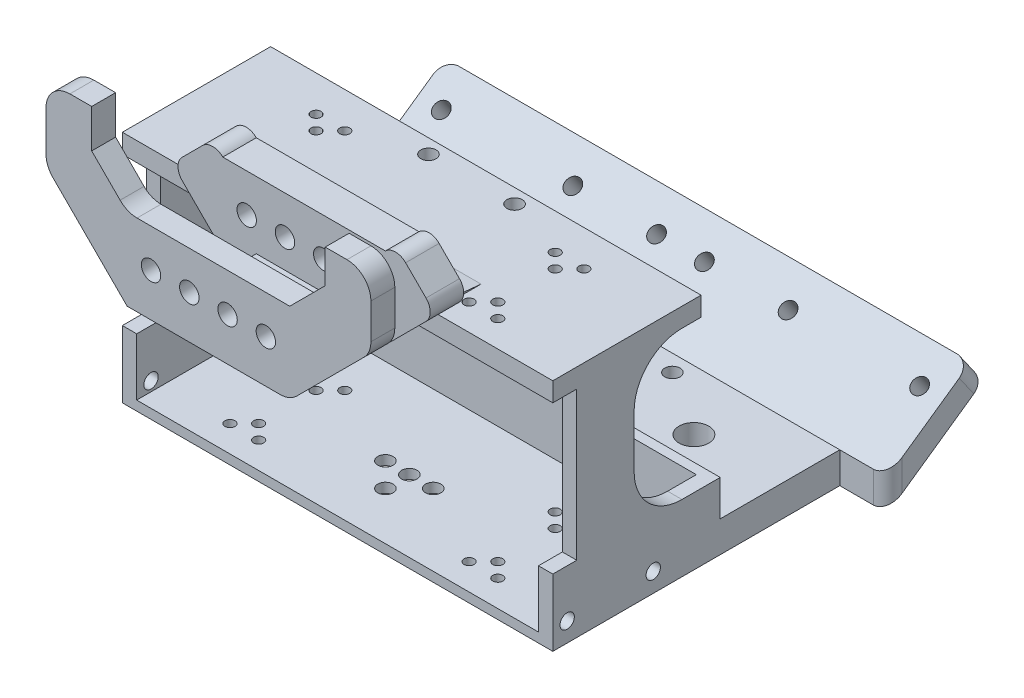
from build123d import *

# Parameters (mm, degrees)
EXTRUDE_1_DEPTH          = 4
EXTRUDE_2_DEPTH          = 7
EXTRUDE_3_DEPTH          = 15
EXTRUDE_4_DEPTH          = 5
CUT_EXTRUDE_2_REACH      = 93.694
SKETCH_6_R               = 2.03
EXTRUDE_5_DEPTH          = 31
EXTRUDE_6_DEPTH          = 12
EXTRUDE_7_DEPTH          = 2
CUT_EXTRUDE_3_DEPTH      = 103.59409284410384
CUT_EXTRUDE_3_DEPTH_BACK = 103.59409284410384
SKETCH_14_R              = 1.049999999999995
SKETCH_14_R_2            = 1.0499999999999985
SKETCH_14_R_3            = 1.049999999999999
SKETCH_14_R_4            = 1.0499999999999987
SKETCH_14_R_5            = 1.050000000000002
SKETCH_14_R_6            = 1.0499999999999916
FILLET_3_R               = 10
FILLET_5_R               = 5
FILLET_9_R               = 3
CUT_EXTRUDE_4_REACH      = 85.223
SKETCH_16_W              = 90.00000000000001
SKETCH_16_H              = 15
EXTRUDE_8_DEPTH          = 25
CUT_EXTRUDE_6_REACH      = 104.594
SKETCH_22_R              = 1.6000000000000003
SKETCH_22_R_2            = 1.6
SKETCH_25_R              = 1.6000000000000019
CUT_EXTRUDE_7_DEPTH      = 4
EXTRUDE_10_DEPTH         = 20
EXTRUDE_11_DEPTH         = 55
CUT_EXTRUDE_8_REACH      = 129.959
SKETCH_31_R              = 1.5999999999999985
SKETCH_31_R_2            = 1.6
SKETCH_31_R_3            = 1.6000000000000019
CUT_EXTRUDE_9_REACH      = 108.605
SKETCH_32_R              = 1.5999999999999992
SKETCH_32_R_2            = 1.6
SKETCH_32_R_3            = 1.6000000000000019
SKETCH_32_R_4            = 1.6000000000000008
SKETCH_32_R_5            = 3.0999999999999996
SKETCH_32_R_6            = 3.0999999999999983
FILLET_12_R              = 3
SKETCH_33_R              = 1.5000000000000004
SKETCH_33_R_2            = 1.5000000000000009
CUT_EXTRUDE_10_DEPTH     = 124.80958192613329


with BuildPart() as part:
    # 草图1 → 凸台-拉伸1 (new body)
    with BuildSketch(Plane(origin=(0, 0, 0), x_dir=(1, 0, 0), z_dir=(0, 1, 0))):
        Polygon((-45.000000000000014, 23), (44.999999999999986, 23), (45, -23), (-45.00000000000001, -23), align=None)
    extrude(amount=EXTRUDE_1_DEPTH)

    # 草图3 → 凸台-拉伸2 (add)
    with BuildSketch(Plane.XY.offset(23)):
        Polygon((-17, 0), (17, 0), (27.606601717798192, 10.606601717798231), (19.10660171779818, 19.106601717798203), (16.999999999999996, 17), (-17.000000000000004, 17), (-19.10660171779818, 19.106601717798203), (-27.606601717798192, 10.606601717798231), align=None)
    extrude(amount=EXTRUDE_2_DEPTH)

    # 草图4 → 凸台-拉伸3 (add)
    with BuildSketch(Plane.XY.offset(30)):
        Polygon((-9.999999999999934, 3.000000000000002), (10.000000000000068, 3.0000000000000013), (10.000000000000068, -1.8e-16), (-9.999999999999932, 1.07e-15), align=None)
    extrude(amount=EXTRUDE_3_DEPTH)

    # 草图5 → 凸台-拉伸4 (add)
    with BuildSketch(Plane.XY.offset(45)):
        Polygon((-33.9632034355964, 25.46320343559641), (-33.963203435596405, 32.46320343559642), (-24.4099025766973, 32.46320343559642), (-24.409902576697295, 24.409902576697302), (-19.10660171779818, 19.106601717798203), (-17.000000000000004, 17), (16.999999999999996, 17), (19.10660171779818, 19.106601717798203), (24.409902576697277, 24.40990257669732), (24.40990257669728, 31.40990257669732), (33.963203435596384, 31.40990257669732), (33.96320343559638, 25.463203435596437), (33.96320343559638, 16.963203435596416), (27.606601717798192, 10.606601717798231), (17, 0), (-17, 0), (-27.606601717798178, 10.60660171779821), (-33.9632034355964, 16.963203435596423), align=None)
    extrude(amount=EXTRUDE_4_DEPTH)

    # 切除-拉伸2: up to this face of the body (flat: up to its plane)
    cut_extrude_2_end = Plane(part.part.faces().sort_by_distance((0, 10.613576842, 23))[0])
    # 草图6 → 切除-拉伸2 (cut, up to the picked face)
    with BuildSketch(Plane.XY.offset(49.99999999999999), mode=Mode.PRIVATE) as cut_extrude_2_sk1:
        with Locations((-12.000000000000004, 9)):
            Circle(SKETCH_6_R)
    cut_extrude_2_tool1 = split(extrude(cut_extrude_2_sk1.sketch, amount=-CUT_EXTRUDE_2_REACH, mode=Mode.PRIVATE), bisect_by=cut_extrude_2_end, keep=Keep.BOTH, mode=Mode.PRIVATE)
    # 草图6 → 切除-拉伸2 (cut, up to the picked face)
    with BuildSketch(Plane.XY.offset(49.99999999999999), mode=Mode.PRIVATE) as cut_extrude_2_sk2:
        with Locations((-4.0000000000000036, 9)):
            Circle(SKETCH_6_R)
    cut_extrude_2_tool2 = split(extrude(cut_extrude_2_sk2.sketch, amount=-CUT_EXTRUDE_2_REACH, mode=Mode.PRIVATE), bisect_by=cut_extrude_2_end, keep=Keep.BOTH, mode=Mode.PRIVATE)
    # 草图6 → 切除-拉伸2 (cut, up to the picked face)
    with BuildSketch(Plane.XY.offset(49.99999999999999), mode=Mode.PRIVATE) as cut_extrude_2_sk3:
        with Locations((3.9999999999999964, 9)):
            Circle(SKETCH_6_R)
    cut_extrude_2_tool3 = split(extrude(cut_extrude_2_sk3.sketch, amount=-CUT_EXTRUDE_2_REACH, mode=Mode.PRIVATE), bisect_by=cut_extrude_2_end, keep=Keep.BOTH, mode=Mode.PRIVATE)
    # 草图6 → 切除-拉伸2 (cut, up to the picked face)
    with BuildSketch(Plane.XY.offset(49.99999999999999), mode=Mode.PRIVATE) as cut_extrude_2_sk4:
        with Locations((11.999999999999996, 9)):
            Circle(SKETCH_6_R)
    cut_extrude_2_tool4 = split(extrude(cut_extrude_2_sk4.sketch, amount=-CUT_EXTRUDE_2_REACH, mode=Mode.PRIVATE), bisect_by=cut_extrude_2_end, keep=Keep.BOTH, mode=Mode.PRIVATE)
    add(cut_extrude_2_tool1.solids().sort_by(Axis((-12, 9, 50), (0, 0, -1)))[0], mode=Mode.SUBTRACT)
    add(cut_extrude_2_tool2.solids().sort_by(Axis((-4, 9, 50), (0, 0, -1)))[0], mode=Mode.SUBTRACT)
    add(cut_extrude_2_tool3.solids().sort_by(Axis((4, 9, 50), (0, 0, -1)))[0], mode=Mode.SUBTRACT)
    add(cut_extrude_2_tool4.solids().sort_by(Axis((12, 9, 50), (0, 0, -1)))[0], mode=Mode.SUBTRACT)

    # 草图11 → 凸台-拉伸5 (add)
    with BuildSketch(Plane.XZ):
        Polygon((-45.000000000000014, 17.999999999999996), (-42.00000000000001, 18), (-42.00000000000001, 5.999999999999995), (-45.000000000000014, 5.999999999999995), align=None)
        Polygon((45.000000000000014, 6.000000000000006), (42.00000000000001, 6.000000000000005), (42.00000000000001, 18.00000000000001), (45.000000000000014, 18.000000000000007), align=None)
    extrude(amount=EXTRUDE_5_DEPTH)

    # 草图12 → 凸台-拉伸6 (add)
    with BuildSketch(Plane.XZ.offset(31)):
        Polygon((42, -10.000000000000004), (42.00000000000001, 23.000000000000004), (45, 23), (44.99999999999999, -12.000000000000004), (-45.000000000000014, -12.000000000000004), (-45.00000000000001, 23), (-42.00000000000001, 23.000000000000004), (-42, -10.000000000000004), align=None)
    extrude(amount=EXTRUDE_6_DEPTH)

    # 草图13 → 凸台-拉伸7 (add)
    with BuildSketch(Plane.XZ.offset(43)):
        Polygon((-45.00000000000001, 23), (44.99999999999999, 23), (44.99999999999999, -12.000000000000004), (-45, -12.000000000000004), align=None)
    extrude(amount=EXTRUDE_7_DEPTH)

    # 草图14 → 切除-拉伸3 (cut, two sides: drawn at the far end of the back side and taken through both)
    with BuildSketch(Plane.XZ.offset(45).offset(-CUT_EXTRUDE_3_DEPTH_BACK)):
        with Locations(Location((22.000000000000007, 17.499999999999993, 0), (0, 0, 270))):
            Circle(SKETCH_14_R)
        with Locations(Location((28, 17.499999999999996, 0), (0, 0, 270))):
            Circle(SKETCH_14_R_2)
        with Locations(Location((25, 14.499999999999995, 0), (0, 0, 270))):
            Circle(SKETCH_14_R_3)
        with Locations(Location((22.000000000000007, -0.5000000000000004, 0), (0, 0, 270))):
            Circle(SKETCH_14_R)
        with Locations(Location((25, 2.499999999999995, 0), (0, 0, 270))):
            Circle(SKETCH_14_R_4)
        with Locations(Location((28, -0.5000000000000039, 0), (0, 0, 270))):
            Circle(SKETCH_14_R_4)
        with Locations(Location((-28, -0.5000000000000108, 0), (0, 0, 270))):
            Circle(SKETCH_14_R_5)
        with Locations(Location((-22.000000000000007, -0.5000000000000059, 0), (0, 0, 270))):
            Circle(SKETCH_14_R_4)
        with Locations(Location((-25, 2.4999999999999893, 0), (0, 0, 270))):
            Circle(SKETCH_14_R_4)
        with Locations(Location((-22.000000000000007, 17.499999999999986, 0), (0, 0, 270))):
            Circle(SKETCH_14_R_6)
        with Locations(Location((-25, 14.49999999999999, 0), (0, 0, 270))):
            Circle(SKETCH_14_R_3)
        with Locations(Location((-28, 17.49999999999999, 0), (0, 0, 270))):
            Circle(SKETCH_14_R_2)
    extrude(amount=CUT_EXTRUDE_3_DEPTH + CUT_EXTRUDE_3_DEPTH_BACK, mode=Mode.SUBTRACT)

    # 圆角3
    fillet_3_edges = [part.edges().sort_by_distance(p)[0] for p in [
        (-43.500000000000014, 0, 5.999999999999995),
        (-43.500000000000014, -31, 5.999999999999995),
        (43.500000000000014, 0, 6.000000000000005),
        (43.500000000000014, -31, 6.000000000000005),
    ]]
    fillet(fillet_3_edges, radius=FILLET_3_R)

    # 圆角5
    fillet_5_edges = [part.edges().sort_by_distance(p)[0] for p in [
        (-17, 0, 26.5),
        (17, 0, 26.5),
        (17, 0, 47.5),
        (33.96320343559638, 16.963203435596416, 47.5),
        (33.963203435596384, 31.40990257669732, 47.5),
        (-17.000000000000004, 17, 47.5),
        (-33.963203435596405, 32.46320343559642, 47.5),
        (-33.9632034355964, 16.963203435596423, 47.5),
    ]]
    fillet(fillet_5_edges, radius=FILLET_5_R)

    # 圆角9
    # the kernel refuses this fillet: 3 mm, written as the material it takes off along each edge
    with BuildSketch(Plane(origin=(-27.606601717798192, 10.606601717798231, 15.499999999999998), x_dir=(0.7071067811865487, 0.7071067811865464, 0), z_dir=(0, 0, 1))) as fillet_9_piece_1:
        with BuildLine():
            CenterArc((FILLET_9_R, -FILLET_9_R), FILLET_9_R, 89.99999999999997, 90.00000000000003)
            Line((-1.28e-15, -FILLET_9_R), (0, 0))
            Line((0, 0), (FILLET_9_R, -6e-17))
        make_face()
    extrude(amount=22, mode=Mode.SUBTRACT)
    with BuildSketch(Plane(origin=(-19.10660171779818, 19.106601717798203, 15.499999999999972), x_dir=(0.7071067811865434, -0.7071067811865517, 0), z_dir=(0, 0, 1))) as fillet_9_piece_2_section:
        with BuildLine():
            CenterArc((FILLET_9_R, -FILLET_9_R), FILLET_9_R, 89.99999999999999, 90.00000000000023)
            Line((1.022e-14, -FILLET_9_R), (0, 0))
            Line((0, 0), (FILLET_9_R, -1e-17))
        make_face()
    fillet_9_piece_2 = extrude(amount=22.000000000000057, mode=Mode.PRIVATE)
    fillet_9_piece_2 = split(fillet_9_piece_2, bisect_by=Plane(origin=(-19.10660171779818, 17, 26.499999999999993), z_dir=(0, 1, 0)), keep=Keep.TOP, mode=Mode.PRIVATE)
    add(fillet_9_piece_2, mode=Mode.SUBTRACT)
    with BuildSketch(Plane(origin=(19.10660171779818, 19.106601717798203, 15.499999999999982), x_dir=(-0.707106781186544, -0.7071067811865511, 0), z_dir=(0, 0, 1))) as fillet_9_piece_3_section:
        with BuildLine():
            CenterArc((FILLET_9_R, FILLET_9_R), FILLET_9_R, 179.99999999999991, 90)
            Line((7.64e-15, FILLET_9_R), (0, 0))
            Line((0, 0), (FILLET_9_R, -5e-17))
        make_face()
    fillet_9_piece_3 = extrude(amount=22.000000000000032, mode=Mode.PRIVATE)
    fillet_9_piece_3 = split(fillet_9_piece_3, bisect_by=Plane(origin=(19.106601717798178, 17, 26.5), z_dir=(0, 1, 0)), keep=Keep.TOP, mode=Mode.PRIVATE)
    add(fillet_9_piece_3, mode=Mode.SUBTRACT)
    with BuildSketch(Plane(origin=(27.606601717798192, 10.606601717798231, 15.499999999999996), x_dir=(-0.7071067811865492, 0.7071067811865457, 0), z_dir=(0, 0, 1))) as fillet_9_piece_4:
        with BuildLine():
            CenterArc((FILLET_9_R, FILLET_9_R), FILLET_9_R, 180.00000000000003, 89.99999999999994)
            Line((2.5e-15, FILLET_9_R), (0, 0))
            Line((0, 0), (FILLET_9_R, -1e-17))
        make_face()
    extrude(amount=22.000000000000004, mode=Mode.SUBTRACT)

    # 草图16 → 切除-拉伸4 (cut, up to next)
    with BuildSketch(Plane(origin=(0, 4, 0), x_dir=(1, 0, 0), z_dir=(0, 1, 0)), mode=Mode.PRIVATE) as cut_extrude_4_sk1:
        with Locations((-7.11e-15, 15.5)):
            Rectangle(SKETCH_16_W, SKETCH_16_H)
    cut_extrude_4_tool1 = extrude(cut_extrude_4_sk1.sketch, amount=-CUT_EXTRUDE_4_REACH, mode=Mode.PRIVATE) & part.part
    add(cut_extrude_4_tool1.solids().sort_by_distance((0, 4, -15.5))[0], mode=Mode.SUBTRACT)

    # 草图17 → 凸台-拉伸8 (add)
    with BuildSketch(Plane(origin=(0, 0, -12.000000000000004), x_dir=(-1, 0, 0), z_dir=(0, 0, -1))):
        Polygon((-44.99999999999999, -45), (45.00000000000001, -45), (45, -38.5), (-44.99999999999999, -38.5), align=None)
    extrude(amount=EXTRUDE_8_DEPTH)

    # 草图22 → 切除-拉伸6 (cut, up to next)
    with BuildSketch(Plane.XZ.offset(45), mode=Mode.PRIVATE) as cut_extrude_6_sk1:
        with Locations(Location((1.22e-15, 13.00000000000001, 0), (0, 0, 270))):
            Circle(SKETCH_22_R)
    cut_extrude_6_tool1 = extrude(cut_extrude_6_sk1.sketch, amount=-CUT_EXTRUDE_6_REACH, mode=Mode.PRIVATE) & part.part
    # 草图22 → 切除-拉伸6 (cut, up to next)
    with BuildSketch(Plane.XZ.offset(45), mode=Mode.PRIVATE) as cut_extrude_6_sk2:
        with Locations(Location((5.000000000000001, 8.00000000000001, 0), (0, 0, 270))):
            Circle(SKETCH_22_R_2)
    cut_extrude_6_tool2 = extrude(cut_extrude_6_sk2.sketch, amount=-CUT_EXTRUDE_6_REACH, mode=Mode.PRIVATE) & part.part
    # 草图22 → 切除-拉伸6 (cut, up to next)
    with BuildSketch(Plane.XZ.offset(45), mode=Mode.PRIVATE) as cut_extrude_6_sk3:
        with Locations(Location((1.22e-15, 8.00000000000001, 0), (0, 0, 270))):
            Circle(SKETCH_22_R)
    cut_extrude_6_tool3 = extrude(cut_extrude_6_sk3.sketch, amount=-CUT_EXTRUDE_6_REACH, mode=Mode.PRIVATE) & part.part
    # 草图22 → 切除-拉伸6 (cut, up to next)
    with BuildSketch(Plane.XZ.offset(45), mode=Mode.PRIVATE) as cut_extrude_6_sk4:
        with Locations(Location((-4.999999999999999, 8.00000000000001, 0), (0, 0, 270))):
            Circle(SKETCH_22_R_2)
    cut_extrude_6_tool4 = extrude(cut_extrude_6_sk4.sketch, amount=-CUT_EXTRUDE_6_REACH, mode=Mode.PRIVATE) & part.part
    add(cut_extrude_6_tool1.solids().sort_by_distance((0, -45, 13))[0], mode=Mode.SUBTRACT)
    add(cut_extrude_6_tool2.solids().sort_by_distance((5, -45, 8))[0], mode=Mode.SUBTRACT)
    add(cut_extrude_6_tool3.solids().sort_by_distance((0, -45, 8))[0], mode=Mode.SUBTRACT)
    add(cut_extrude_6_tool4.solids().sort_by_distance((-5, -45, 8))[0], mode=Mode.SUBTRACT)

    # 草图25 → 切除-拉伸7 (cut)
    with BuildSketch(Plane.XZ):
        with Locations(Location((-8.999999999999998, 22, 0), (0, 0, 270))):
            Circle(SKETCH_25_R)
        with Locations(Location((9, 22, 0), (0, 0, 270))):
            Circle(SKETCH_25_R)
        with Locations(Location((8.999999999999998, -5.000000000000002, 0), (0, 0, 270))):
            Circle(SKETCH_25_R)
        with Locations(Location((-8.999999999999998, -5.000000000000003, 0), (0, 0, 270))):
            Circle(SKETCH_25_R)
    extrude(amount=-CUT_EXTRUDE_7_DEPTH, mode=Mode.SUBTRACT)

    # 草图28 → 凸台-拉伸10 (add, symmetric)
    with BuildSketch(Plane(origin=(0, 0, 0), x_dir=(0, 0, -1), z_dir=(1, 0, 0))):
        Polygon((-23.000000000000004, 3.9999999999999947), (-13.000000000000004, 4), (-23.000000000000004, 4.999999999999995), align=None)
    extrude(amount=EXTRUDE_10_DEPTH, both=True)

    # 草图29 → 凸台-拉伸11 (add, symmetric)
    with BuildSketch(Plane(origin=(0, 0, 0), x_dir=(0, 0, -1), z_dir=(1, 0, 0))):
        Polygon((37.00000000000001, -38.5), (54.42480008967064, -26.299023625415437), (57.47880110722485, -30.66058909122389), (37.00000000000001, -45), align=None)
    extrude(amount=EXTRUDE_11_DEPTH, both=True)

    # 草图31 → 切除-拉伸8 (cut, up to next)
    with BuildSketch(Plane(origin=(0, -47.57976670936693, -33.31571131615795), x_dir=(1, 0, 0), z_dir=(0, -0.8191520442889931, -0.5735764363510442)), mode=Mode.PRIVATE) as cut_extrude_8_sk1:
        with Locations(Location((-49.99999999999999, -22.497686002895787, 0), (0, 0, 270))):
            Circle(SKETCH_31_R)
    cut_extrude_8_tool1 = extrude(cut_extrude_8_sk1.sketch, amount=-CUT_EXTRUDE_8_REACH, mode=Mode.PRIVATE) & part.part
    # 草图31 → 切除-拉伸8 (cut, up to next)
    with BuildSketch(Plane(origin=(0, -47.57976670936693, -33.31571131615795), x_dir=(1, 0, 0), z_dir=(0, -0.8191520442889931, -0.5735764363510442)), mode=Mode.PRIVATE) as cut_extrude_8_sk2:
        with Locations(Location((-4.999999999999999, -22.49768600289579, 0), (0, 0, 270))):
            Circle(SKETCH_31_R_2)
    cut_extrude_8_tool2 = extrude(cut_extrude_8_sk2.sketch, amount=-CUT_EXTRUDE_8_REACH, mode=Mode.PRIVATE) & part.part
    # 草图31 → 切除-拉伸8 (cut, up to next)
    with BuildSketch(Plane(origin=(0, -47.57976670936693, -33.31571131615795), x_dir=(1, 0, 0), z_dir=(0, -0.8191520442889931, -0.5735764363510442)), mode=Mode.PRIVATE) as cut_extrude_8_sk3:
        with Locations(Location((5.000000000000001, -22.49768600289579, 0), (0, 0, 270))):
            Circle(SKETCH_31_R_2)
    cut_extrude_8_tool3 = extrude(cut_extrude_8_sk3.sketch, amount=-CUT_EXTRUDE_8_REACH, mode=Mode.PRIVATE) & part.part
    # 草图31 → 切除-拉伸8 (cut, up to next)
    with BuildSketch(Plane(origin=(0, -47.57976670936693, -33.31571131615795), x_dir=(1, 0, 0), z_dir=(0, -0.8191520442889931, -0.5735764363510442)), mode=Mode.PRIVATE) as cut_extrude_8_sk4:
        with Locations(Location((50, -22.49768600289579, 0), (0, 0, 270))):
            Circle(SKETCH_31_R)
    cut_extrude_8_tool4 = extrude(cut_extrude_8_sk4.sketch, amount=-CUT_EXTRUDE_8_REACH, mode=Mode.PRIVATE) & part.part
    # 草图31 → 切除-拉伸8 (cut, up to next)
    with BuildSketch(Plane(origin=(0, -47.57976670936693, -33.31571131615795), x_dir=(1, 0, 0), z_dir=(0, -0.8191520442889931, -0.5735764363510442)), mode=Mode.PRIVATE) as cut_extrude_8_sk5:
        with Locations(Location((-22.499999999999996, -22.49768600289579, 0), (0, 0, 270))):
            Circle(SKETCH_31_R_3)
    cut_extrude_8_tool5 = extrude(cut_extrude_8_sk5.sketch, amount=-CUT_EXTRUDE_8_REACH, mode=Mode.PRIVATE) & part.part
    # 草图31 → 切除-拉伸8 (cut, up to next)
    with BuildSketch(Plane(origin=(0, -47.57976670936693, -33.31571131615795), x_dir=(1, 0, 0), z_dir=(0, -0.8191520442889931, -0.5735764363510442)), mode=Mode.PRIVATE) as cut_extrude_8_sk6:
        with Locations(Location((22.500000000000004, -22.49768600289579, 0), (0, 0, 270))):
            Circle(SKETCH_31_R_3)
    cut_extrude_8_tool6 = extrude(cut_extrude_8_sk6.sketch, amount=-CUT_EXTRUDE_8_REACH, mode=Mode.PRIVATE) & part.part
    add(cut_extrude_8_tool1.solids().sort_by_distance((-50, -34.675624, -51.744737))[0], mode=Mode.SUBTRACT)
    add(cut_extrude_8_tool2.solids().sort_by_distance((-5, -34.675624, -51.744737))[0], mode=Mode.SUBTRACT)
    add(cut_extrude_8_tool3.solids().sort_by_distance((5, -34.675624, -51.744737))[0], mode=Mode.SUBTRACT)
    add(cut_extrude_8_tool4.solids().sort_by_distance((50, -34.675624, -51.744737))[0], mode=Mode.SUBTRACT)
    add(cut_extrude_8_tool5.solids().sort_by_distance((-22.5, -34.675624, -51.744737))[0], mode=Mode.SUBTRACT)
    add(cut_extrude_8_tool6.solids().sort_by_distance((22.5, -34.675624, -51.744737))[0], mode=Mode.SUBTRACT)

    # 草图32 → 切除-拉伸9 (cut, up to next)
    with BuildSketch(Plane(origin=(0, -38.5, 0), x_dir=(1, 0, 0), z_dir=(0, 1, 0)), mode=Mode.PRIVATE) as cut_extrude_9_sk1:
        with Locations(Location((13.500000000000014, 33.5, 0), (0, 0, 270))):
            Circle(SKETCH_32_R)
    cut_extrude_9_tool1 = extrude(cut_extrude_9_sk1.sketch, amount=-CUT_EXTRUDE_9_REACH, mode=Mode.PRIVATE) & part.part
    # 草图32 → 切除-拉伸9 (cut, up to next)
    with BuildSketch(Plane(origin=(0, -38.5, 0), x_dir=(1, 0, 0), z_dir=(0, 1, 0)), mode=Mode.PRIVATE) as cut_extrude_9_sk2:
        with Locations(Location((13.500000000000014, 15.5, 0), (0, 0, 270))):
            Circle(SKETCH_32_R_2)
    cut_extrude_9_tool2 = extrude(cut_extrude_9_sk2.sketch, amount=-CUT_EXTRUDE_9_REACH, mode=Mode.PRIVATE) & part.part
    # 草图32 → 切除-拉伸9 (cut, up to next)
    with BuildSketch(Plane(origin=(0, -38.5, 0), x_dir=(1, 0, 0), z_dir=(0, 1, 0)), mode=Mode.PRIVATE) as cut_extrude_9_sk3:
        with Locations(Location((-13.499999999999984, 15.5, 0), (0, 0, 270))):
            Circle(SKETCH_32_R_3)
    cut_extrude_9_tool3 = extrude(cut_extrude_9_sk3.sketch, amount=-CUT_EXTRUDE_9_REACH, mode=Mode.PRIVATE) & part.part
    # 草图32 → 切除-拉伸9 (cut, up to next)
    with BuildSketch(Plane(origin=(0, -38.5, 0), x_dir=(1, 0, 0), z_dir=(0, 1, 0)), mode=Mode.PRIVATE) as cut_extrude_9_sk4:
        with Locations(Location((-13.499999999999988, 33.5, 0), (0, 0, 270))):
            Circle(SKETCH_32_R_4)
    cut_extrude_9_tool4 = extrude(cut_extrude_9_sk4.sketch, amount=-CUT_EXTRUDE_9_REACH, mode=Mode.PRIVATE) & part.part
    # 草图32 → 切除-拉伸9 (cut, up to next)
    with BuildSketch(Plane(origin=(0, -38.5, 0), x_dir=(1, 0, 0), z_dir=(0, 1, 0)), mode=Mode.PRIVATE) as cut_extrude_9_sk5:
        with Locations(Location((1.388e-14, 24.5, 0), (0, 0, 270))):
            Circle(SKETCH_32_R_5)
    cut_extrude_9_tool5 = extrude(cut_extrude_9_sk5.sketch, amount=-CUT_EXTRUDE_9_REACH, mode=Mode.PRIVATE) & part.part
    # 草图32 → 切除-拉伸9 (cut, up to next)
    with BuildSketch(Plane(origin=(0, -38.5, 0), x_dir=(1, 0, 0), z_dir=(0, 1, 0)), mode=Mode.PRIVATE) as cut_extrude_9_sk6:
        with Locations(Location((27.000000000000014, 24.5, 0), (0, 0, 270))):
            Circle(SKETCH_32_R_6)
    cut_extrude_9_tool6 = extrude(cut_extrude_9_sk6.sketch, amount=-CUT_EXTRUDE_9_REACH, mode=Mode.PRIVATE) & part.part
    # 草图32 → 切除-拉伸9 (cut, up to next)
    with BuildSketch(Plane(origin=(0, -38.5, 0), x_dir=(1, 0, 0), z_dir=(0, 1, 0)), mode=Mode.PRIVATE) as cut_extrude_9_sk7:
        with Locations(Location((-26.999999999999986, 24.5, 0), (0, 0, 270))):
            Circle(SKETCH_32_R_6)
    cut_extrude_9_tool7 = extrude(cut_extrude_9_sk7.sketch, amount=-CUT_EXTRUDE_9_REACH, mode=Mode.PRIVATE) & part.part
    add(cut_extrude_9_tool1.solids().sort_by_distance((13.5, -38.5, -33.5))[0], mode=Mode.SUBTRACT)
    add(cut_extrude_9_tool2.solids().sort_by_distance((13.5, -38.5, -15.5))[0], mode=Mode.SUBTRACT)
    add(cut_extrude_9_tool3.solids().sort_by_distance((-13.5, -38.5, -15.5))[0], mode=Mode.SUBTRACT)
    add(cut_extrude_9_tool4.solids().sort_by_distance((-13.5, -38.5, -33.5))[0], mode=Mode.SUBTRACT)
    add(cut_extrude_9_tool5.solids().sort_by_distance((0, -38.5, -24.5))[0], mode=Mode.SUBTRACT)
    add(cut_extrude_9_tool6.solids().sort_by_distance((27, -38.5, -24.5))[0], mode=Mode.SUBTRACT)
    add(cut_extrude_9_tool7.solids().sort_by_distance((-27, -38.5, -24.5))[0], mode=Mode.SUBTRACT)

    # 圆角12
    fillet_12_edges = [part.edges().sort_by_distance(p)[0] for p in [
        (-55, -41.75, -37.00000000000001),
        (-55, -28.479806358319664, -55.95180059844774),
        (55, -41.75, -37.00000000000001),
        (55, -28.479806358319664, -55.95180059844774),
    ]]
    fillet(fillet_12_edges, radius=FILLET_12_R)

    # 草图33 → 切除-拉伸10 (cut, through all)
    with BuildSketch(Plane(origin=(44.99999999999999, 0, -1.358e-14), x_dir=(-3e-16, 0, -1), z_dir=(1, 0, -3e-16))):
        with Locations((-2.0000000000000155, -40.99999999999999)):
            Circle(SKETCH_33_R)
        with Locations((-20.000000000000018, -40.99999999999999)):
            Circle(SKETCH_33_R_2)
    extrude(amount=-CUT_EXTRUDE_10_DEPTH, mode=Mode.SUBTRACT)


solid = part.part
